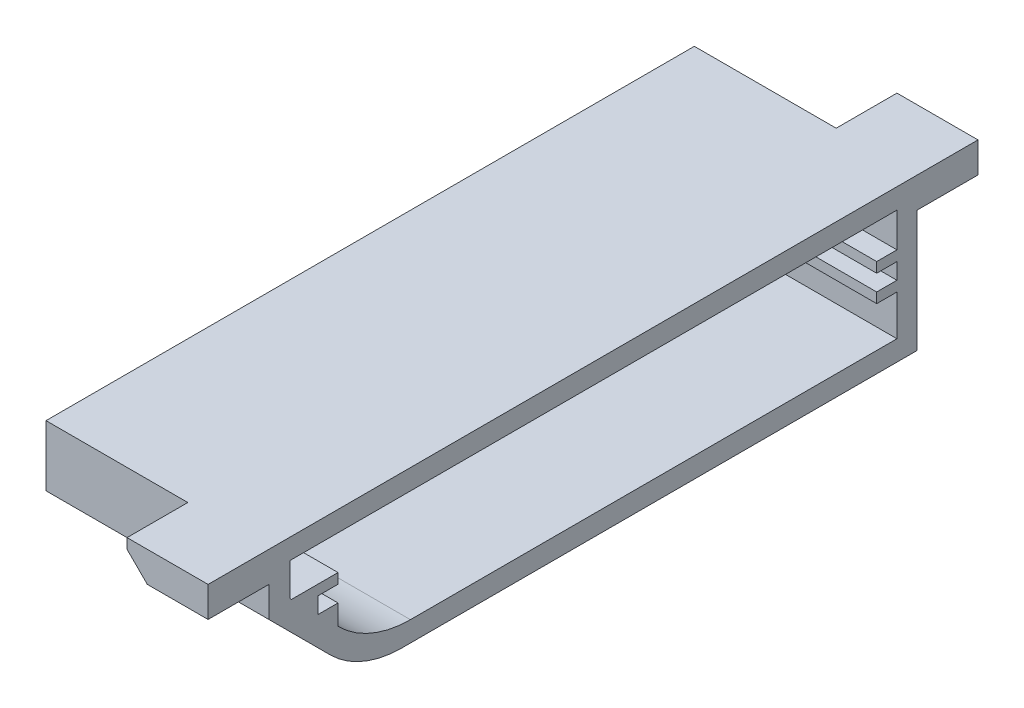
from build123d import *

# Parameters (mm, degrees)
SKETCH_1_W      = 22
SKETCH_1_H      = 15
EXTRUDE_1_DEPTH = 2
SKETCH_2_W      = 22
SKETCH_2_H      = 30
EXTRUDE_2_DEPTH = 2
EXTRUDE_3_DEPTH = 22
SKETCH_4_W      = 8
SKETCH_4_H      = 3
EXTRUDE_4_DEPTH = 6
SKETCH_5_W      = 8
SKETCH_5_H      = 3
EXTRUDE_5_DEPTH = 6
CHAMFER_1_SIZE  = 2
SKETCH_6_W      = 2
SKETCH_6_H      = 1
EXTRUDE_6_DEPTH = 22
FILLET_1_R      = 10


with BuildPart() as part:
    # 草图1 → 凸台-拉伸1 (new body)
    with BuildSketch(Plane.XY):
        with Locations((11, 7.5)):
            Rectangle(SKETCH_1_W, SKETCH_1_H)
    extrude(amount=EXTRUDE_1_DEPTH)

    # 草图2 → 凸台-拉伸2 (add)
    with BuildSketch(Plane.XZ):
        with Locations((11, 15)):
            Rectangle(SKETCH_2_W, SKETCH_2_H)
    extrude(amount=-EXTRUDE_2_DEPTH)

    # 草图3 → 凸台-拉伸3 (add)
    with BuildSketch(Plane.ZY):
        Polygon((0, 15), (0, 13), (61.931971091, 13), (61.931971091, 9.760398216), (54.171572875, 2), (30, 2), (30, 0), (55, 0), (64, 9), (64, 15), align=None)
    extrude(amount=-EXTRUDE_3_DEPTH)

    # 草图4 → 凸台-拉伸4 (add)
    with BuildSketch(Plane.XY.offset(64)):
        with Locations((18, 13.5)):
            Rectangle(SKETCH_4_W, SKETCH_4_H)
    extrude(amount=EXTRUDE_4_DEPTH)

    # 草图5 → 凸台-拉伸5 (add)
    with BuildSketch(Plane(origin=(0, 0, 0), x_dir=(-1, 0, 0), z_dir=(0, 0, -1))):
        with Locations((-18, 13.5)):
            Rectangle(SKETCH_5_W, SKETCH_5_H)
    extrude(amount=EXTRUDE_5_DEPTH)

    # 倒角1
    chamfer_1_edges = [part.edges().sort_by_distance(p)[0] for p in [
        (14, 12, 67),
        (14, 12, -3),
    ]]
    chamfer(chamfer_1_edges, length=CHAMFER_1_SIZE)

    # 草图6 → 凸台-拉伸6 (add)
    with BuildSketch(Plane.ZY):
        Polygon((57.171572875, 7), (59.171572875, 7), (59.171572875, 8.6), (57.171572875, 8.6), (57.171572875, 9.6), (61.771572875, 9.6), (61.771572875, 7.925359102), (60.513582407, 7.925359102), (60.513582407, 6.316484683), (59.171572875, 6.316484683), (59.171572875, 5), (57.171572875, 5), align=None)
        with Locations((3, 6.5)):
            Rectangle(SKETCH_6_W, SKETCH_6_H)
        with Locations((3, 9.1)):
            Rectangle(SKETCH_6_W, SKETCH_6_H)
    extrude(amount=-EXTRUDE_6_DEPTH)

    # 圆角1
    fillet_1_edges = [part.edges().sort_by_distance(p)[0] for p in [
        (11, 0, 55),
        (11, 2, 54.171572875),
    ]]
    fillet(fillet_1_edges, radius=FILLET_1_R)


solid = part.part
